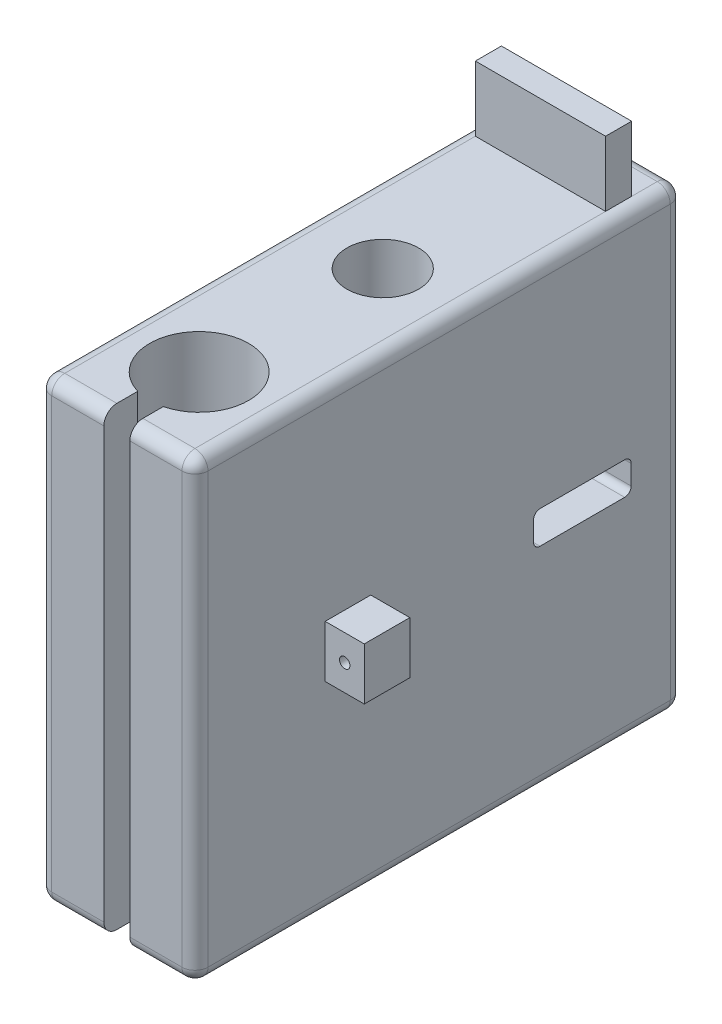
from build123d import *

# Parameters (mm, degrees)
RESSALTO_EXTRUS_O1_DEPTH                   = 12
RESSALTO_EXTRUS_O1_DEPTH_BACK              = 12
ESBO_O1_W                                  = 75
ESBO_O1_H                                  = 70
ESBO_O3_R                                  = 5.5
CORTE_EXTRUS_O1_DEPTH                      = 525.799189678
ESBO_O4_R                                  = 4.1
CORTE_EXTRUS_O2_DEPTH                      = 20
FILETE1_R                                  = 2
CORTE_EXTRUS_O3_DEPTH                      = 29
CORTE_EXTRUS_O4_DEPTH                      = 28
RESSALTO_EXTRUS_O2_DEPTH                   = 6
RESSALTO_EXTRUS_O2_DEPTH_BACK              = 30
ESBO_O7_W                                  = 7
ESBO_O7_H                                  = 8
BROCA_DE_ROSQUEAR_PARA_TARRAXA_DE_M2X0_4_D = 1.6
BROCA_DE_ROSQUEAR_PARA_TARRAXA_DE_M2_2_D   = 1.6
ESBO_O18_W                                 = 20
ESBO_O18_H                                 = 4
RESSALTO_EXTRUS_O3_DEPTH                   = 10


with BuildPart() as part:
    # Esboço1 → Ressalto-extrusão1 (new, two sides: drawn at the far end of the back side and taken through both)
    with BuildSketch(Plane(origin=(-220, 0, 0), x_dir=(0, 0, -1), z_dir=(1, 0, 0)).offset(-RESSALTO_EXTRUS_O1_DEPTH_BACK)):
        with Locations((-427.999935002, 213.253952806)):
            Rectangle(ESBO_O1_W, ESBO_O1_H)
    extrude(amount=RESSALTO_EXTRUS_O1_DEPTH + RESSALTO_EXTRUS_O1_DEPTH_BACK)

    # Esboço3 → Corte-extrusão1 (cut, through all)
    with BuildSketch(Plane(origin=(0, 248.253952806, 0), x_dir=(1, 0, 0), z_dir=(0, 1, 0))):
        with Locations((-219.508549322, -425.149935105)):
            Circle(ESBO_O3_R)
        with BuildLine():
            Line((-220, -465.499935002), (-218, -465.499935002))
            Line((-218, -465.499935002), (-218, -460.369179456))
            ThreePointArc((-218, -460.369179456), (-219.711945476, -445.401349285), (-222, -460.292000844))
            Line((-222, -460.292000844), (-222, -465.499935002))
            Line((-222, -465.499935002), (-220, -465.499935002))
        make_face()
    extrude(amount=-CORTE_EXTRUS_O1_DEPTH, mode=Mode.SUBTRACT)

    # Esboço4 → Corte-extrusão2 (cut)
    with BuildSketch(Plane(origin=(0, 0, 390.499935002), x_dir=(-1, 0, 0), z_dir=(0, 0, -1))):
        with Locations((219.858557552, 238.253952806)):
            Circle(ESBO_O4_R)
        with Locations((219.858557552, 188.253952806)):
            Circle(ESBO_O4_R)
    extrude(amount=-CORTE_EXTRUS_O2_DEPTH, mode=Mode.SUBTRACT)

    # Filete1
    filete1_edges = [part.edges().sort_by_distance(p)[0] for p in [
        (-227, 178.253952806, 465.499935002),
        (-213, 178.253952806, 465.499935002),
        (-213, 248.253952806, 465.499935002),
        (-227, 248.253952806, 465.499935002),
        (-208, 178.253952806, 427.999935002),
        (-208, 248.253952806, 427.999935002),
        (-208, 213.253952806, 465.499935002),
        (-232, 178.253952806, 427.999935002),
        (-232, 213.253952806, 465.499935002),
        (-232, 248.253952806, 427.999935002),
        (-220, 248.253952806, 390.499935002),
        (-220, 178.253952806, 390.499935002),
        (-208, 213.253952806, 390.499935002),
        (-232, 213.253952806, 390.499935002),
    ]]
    fillet(filete1_edges, radius=FILETE1_R)

    # Esboço5 → Corte-extrusão3 (cut)
    with BuildSketch(Plane(origin=(0, 0, 390.499935002), x_dir=(-1, 0, 0), z_dir=(0, 0, -1))):
        Polygon((213.998414729, 195.258577801), (225.998410699, 195.248743594), (226.027913319, 231.248731505), (214.027917349, 231.258565712), align=None)
    extrude(amount=-CORTE_EXTRUS_O3_DEPTH, mode=Mode.SUBTRACT)

    # Esboço6 → Corte-extrusão4 (cut)
    with BuildSketch(Plane.ZY.offset(232)):
        with BuildLine():
            Line((399.499935002, 215.753952806), (412.499935002, 215.753952806))
            ThreePointArc((412.499935002, 215.753952806), (413.207041783, 215.461059587), (413.499935002, 214.753952806))
            Line((413.499935002, 214.753952806), (413.499935002, 211.753952806))
            ThreePointArc((413.499935002, 211.753952806), (413.207041783, 211.046846025), (412.499935002, 210.753952806))
            Line((412.499935002, 210.753952806), (399.499935002, 210.753952806))
            ThreePointArc((399.499935002, 210.753952806), (398.792828221, 211.046846025), (398.499935002, 211.753952806))
            Line((398.499935002, 211.753952806), (398.499935002, 214.753952806))
            ThreePointArc((398.499935002, 214.753952806), (398.792828221, 215.461059587), (399.499935002, 215.753952806))
        make_face()
    extrude(amount=-CORTE_EXTRUS_O4_DEPTH, mode=Mode.SUBTRACT)

    # Esboço7 → Ressalto-extrusão2 (add, two sides: drawn at the far end of the back side and taken through both)
    with BuildSketch(Plane(origin=(-208, 0, 0), x_dir=(0, 0, -1), z_dir=(1, 0, 0)).offset(-RESSALTO_EXTRUS_O2_DEPTH_BACK)):
        with Locations((-441.999935002, 213.253952806)):
            Rectangle(ESBO_O7_W, ESBO_O7_H)
    extrude(amount=RESSALTO_EXTRUS_O2_DEPTH + RESSALTO_EXTRUS_O2_DEPTH_BACK)

    # Broca de rosquear para tarraxa de M2x0.4 (through all)
    with Locations(Plane.XY.offset(445.499935002)):
        with Locations((-205, 213.253952806)):
            Hole(BROCA_DE_ROSQUEAR_PARA_TARRAXA_DE_M2X0_4_D / 2)

    # Broca de rosquear para tarraxa de M2 2 (through all)
    with Locations(Plane.XY.offset(445.499935002)):
        with Locations((-235, 213.253952806)):
            Hole(BROCA_DE_ROSQUEAR_PARA_TARRAXA_DE_M2_2_D / 2)

    # Esboço18 → Ressalto-extrusão3 (add)
    with BuildSketch(Plane(origin=(0, 248.253952806, 0), x_dir=(1, 0, 0), z_dir=(0, 1, 0))):
        with Locations((-220, -398.434558943)):
            Rectangle(ESBO_O18_W, ESBO_O18_H)
    extrude(amount=RESSALTO_EXTRUS_O3_DEPTH)


solid = part.part
